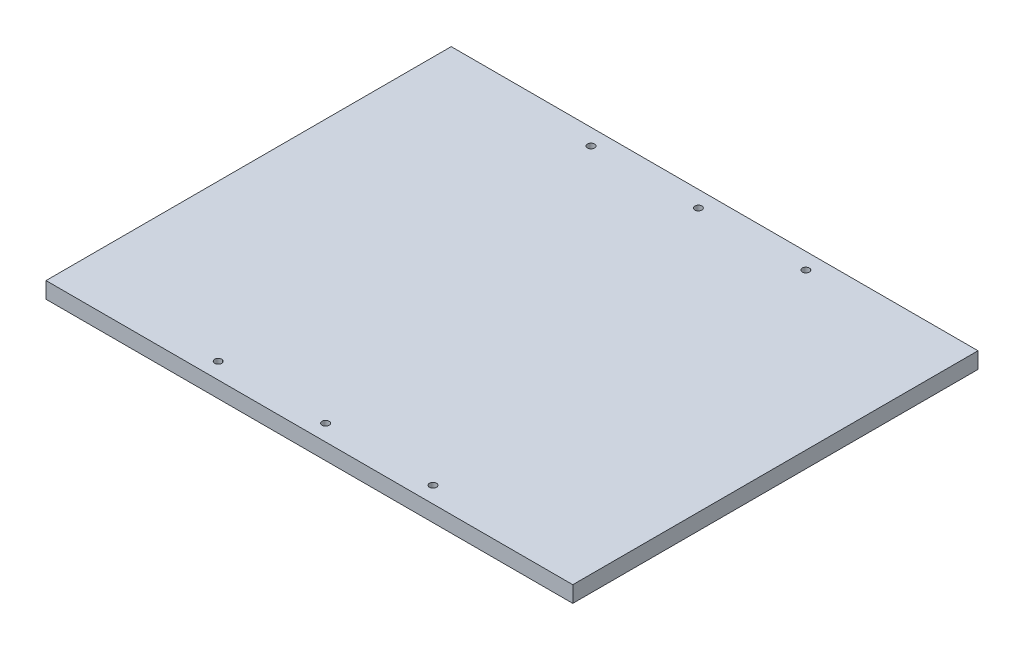
from build123d import *

# Parameters (mm, degrees)
SKIZZE1_W                       = 260
SKIZZE1_H                       = 200
SKIZZE1_R                       = 1.75
AUFSATZ_LINEAR_AUSTRAGEN1_DEPTH = 8


with BuildPart() as part:
    # Skizze1 → Aufsatz-Linear austragen1 (new body)
    with BuildSketch(Plane(origin=(0, 0, 0), x_dir=(1, 0, 0), z_dir=(0, 1, 0))):
        Rectangle(SKIZZE1_W, SKIZZE1_H)
        with Locations((-53, -92)):
            Circle(SKIZZE1_R, mode=Mode.SUBTRACT)
        with Locations((53, -92)):
            Circle(SKIZZE1_R, mode=Mode.SUBTRACT)
        with Locations((0, -92)):
            Circle(SKIZZE1_R, mode=Mode.SUBTRACT)
        with Locations((0, 92)):
            Circle(SKIZZE1_R, mode=Mode.SUBTRACT)
        with Locations((53, 92)):
            Circle(SKIZZE1_R, mode=Mode.SUBTRACT)
        with Locations((-53, 92)):
            Circle(SKIZZE1_R, mode=Mode.SUBTRACT)
    extrude(amount=AUFSATZ_LINEAR_AUSTRAGEN1_DEPTH)


solid = part.part
